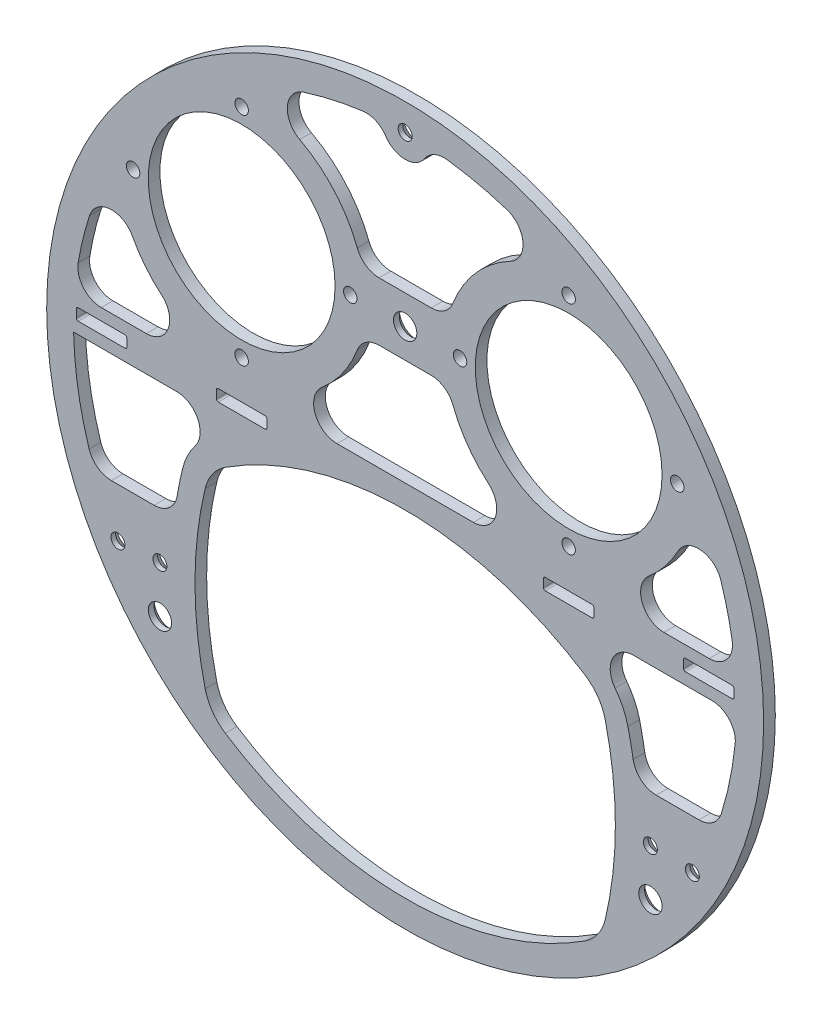
from build123d import *

# Parameters (mm, degrees)
SKETCH1_R                                     = 97.4725
SKETCH1_R_2                                   = 90.16999999999999
BOSS_EXTRUDE1_DEPTH                           = 3.175
BOSS_EXTRUDE2_START                           = -3.175
BOSS_EXTRUDE2_DEPTH                           = 3.175
CIRPATTERN2_COUNT                             = 3
BOSS_EXTRUDE3_DEPTH                           = 3.175
FILLET1_R                                     = 3.175
BOSS_EXTRUDE4_DEPTH                           = 3.175
SKETCH11_R                                    = 3.174999999999997
CUT_EXTRUDE1_DEPTH                            = 138.88349117098826
CHAMFER1_SIZE                                 = 1.5875
CSK_FOR_6_FLAT_HEAD_MACHINE_SCREW1_AT_2_COUNT = 2
CSK_FOR_6_FLAT_HEAD_MACHINE_SCREW1_AT_2_PITCH = 133.35000000000002
BOSS_EXTRUDE5_DEPTH                           = 3.175
BOSS_EXTRUDE6_START                           = -3.175
SKETCH16_R                                    = 25.4
SKETCH16_R_2                                  = 25.400000000000002
BOSS_EXTRUDE6_DEPTH                           = 3.175
FILLET2_R                                     = 6.35
FILLET5_DEPTH                                 = 3.175
CIRPATTERN3_COUNT                             = 4
SKETCH19_R                                    = 3.174999999999999
CUT_EXTRUDE2_DEPTH                            = 138.88349117098826
CHAMFER2_SIZE                                 = 1.5875
FILLET6_R                                     = 0.508


with BuildPart() as part:
    # Sketch1 → Boss-Extrude1 (new body)
    with BuildSketch(Plane.XY):
        Circle(SKETCH1_R)
        Circle(SKETCH1_R_2, mode=Mode.SUBTRACT)
    extrude(amount=BOSS_EXTRUDE1_DEPTH)

    # Sketch2 → Boss-Extrude2 (add)
    with BuildSketch(Plane.XY.offset(3.175).offset(BOSS_EXTRUDE2_START)):
        with BuildLine():
            ThreePointArc((-5.291472463870123, 86.65961267605633), (-1.02e-15, 83.81999999999998), (5.291472463870119, 86.65961267605633))
            ThreePointArc((5.291472463870119, 86.65961267605633), (7.9402616920959765, 88.92319498452717), (11.38468317984177, 89.4484090909091))
            ThreePointArc((11.38468317984177, 89.4484090909091), (5.52e-15, 90.17), (-11.38468317984177, 89.4484090909091))
            ThreePointArc((-11.38468317984177, 89.4484090909091), (-7.940261692095977, 88.92319498452717), (-5.291472463870123, 86.65961267605633))
        make_face()
    boss_extrude2 = extrude(amount=BOSS_EXTRUDE2_DEPTH)

    # Sketch7 → CSK for #6 Flat Head Machine Screw2 (revolve, cut)
    with BuildSketch(Plane(origin=(0, 90.16999999999999, 0), x_dir=(0, 1, 0), z_dir=(1, 0, 0))):
        Polygon((0, 0), (-7.8e-16, 3.1749999999999994), (1.8986499999999988, 3.1749999999999994), (1.898649999999999, 1.891953400936034), (3.5433, 0), align=None)
    csk_for_6_flat_head_machine_screw2 = revolve(axis=Axis((0, 90.16999999999999, -6.349999999999991), (0, 0, 1)), mode=Mode.SUBTRACT)

    # CirPattern2: Boss-Extrude2, CSK for #6 Flat Head Machine Screw2 ×3 about axis
    cirpattern2_axis = Axis((-3.86e-15, -4.54e-15, 0), (0, 0, 1))
    add([boss_extrude2.rotate(cirpattern2_axis, i * 360 / CIRPATTERN2_COUNT) for i in range(1, CIRPATTERN2_COUNT)])
    add([csk_for_6_flat_head_machine_screw2.rotate(cirpattern2_axis, i * 360 / CIRPATTERN2_COUNT) for i in range(1, CIRPATTERN2_COUNT)], mode=Mode.SUBTRACT)

    # Sketch9 → Boss-Extrude3 (add)
    with BuildSketch(Plane.XY):
        with BuildLine():
            ThreePointArc((-60.552516274363704, -19.396575562370977), (-63.50000000000001, -44.44999999999999), (-60.55251627436369, -69.50342443762905))
            ThreePointArc((-60.55251627436369, -69.50342443762905), (-57.57296062941026, -76.08635223992763), (-52.35610155826709, -81.08605940370039))
            ThreePointArc((-52.35610155826709, -81.08605940370039), (2.734e-14, -96.52000000000004), (52.35610155826709, -81.08605940370035))
            ThreePointArc((52.35610155826709, -81.08605940370035), (57.57296062941024, -76.0863522399276), (60.55251627436368, -69.50342443762905))
            ThreePointArc((60.55251627436368, -69.50342443762905), (63.49999999999998, -44.45000000000001), (60.55251627436369, -19.396575562370966))
            ThreePointArc((60.55251627436369, -19.396575562370966), (57.57296062941026, -12.813647760072387), (52.356101558267085, -7.81394059629963))
            ThreePointArc((52.356101558267085, -7.81394059629963), (8.1e-16, 7.6200000000000045), (-52.35610155826708, -7.8139405962996396))
            ThreePointArc((-52.35610155826708, -7.8139405962996396), (-57.572960629410254, -12.813647760072396), (-60.552516274363704, -19.396575562370977))
        make_face()
        with BuildLine():
            ThreePointArc((48.911621192591625, -13.148549767595705), (2.185e-14, 1.2700000000000102), (-48.911621192591625, -13.148549767595705))
            ThreePointArc((-48.911621192591625, -13.148549767595705), (-52.389527240020406, -16.481687876777546), (-54.37589766998936, -20.87030641164326))
            ThreePointArc((-54.37589766998936, -20.87030641164326), (-57.15000000000001, -44.44999999999999), (-54.37589766998935, -68.02969358835675))
            ThreePointArc((-54.37589766998935, -68.02969358835675), (-52.389527240020385, -72.41831212322246), (-48.91162119259161, -75.7514502324043))
            ThreePointArc((-48.91162119259161, -75.7514502324043), (5.52e-15, -90.17), (48.91162119259161, -75.7514502324043))
            ThreePointArc((48.91162119259161, -75.7514502324043), (52.389527240020385, -72.41831212322246), (54.37589766998935, -68.02969358835675))
            ThreePointArc((54.37589766998935, -68.02969358835675), (57.15, -44.45), (54.37589766998936, -20.87030641164326))
            ThreePointArc((54.37589766998936, -20.87030641164326), (52.389527240020406, -16.481687876777542), (48.911621192591625, -13.148549767595705))
        make_face(mode=Mode.SUBTRACT)
    extrude(amount=BOSS_EXTRUDE3_DEPTH)

    # Fillet1
    fillet1_edges = [part.edges().sort_by_distance(p)[0] for p in [
        (-61.30114192312411, -66.12714192312407, 1.5875),
        (61.30114192312409, -66.1271419231241, 1.5875),
    ]]
    fillet(fillet1_edges, radius=FILLET1_R)

    # Sketch10 → Boss-Extrude4 (add)
    with BuildSketch(Plane(origin=(0, 0, 0), x_dir=(-1, 0, 0), z_dir=(0, 0, -1))):
        with BuildLine():
            Line((-84.39529844724764, -31.75), (-62.75033815245173, -31.749999999999993))
            ThreePointArc((-62.75033815245173, -31.749999999999993), (-63.49920304425165, -44.035196298316606), (-62.84477262950386, -56.325784874401805))
            ThreePointArc((-62.84477262950386, -56.325784874401805), (-64.73526297869294, -59.58708179111672), (-68.40927865363547, -58.74350597376062))
            ThreePointArc((-68.40927865363547, -58.74350597376062), (-70.12162004863966, -56.688511197192476), (-71.77225301090981, -54.58362939323426))
            ThreePointArc((-71.77225301090981, -54.58362939323426), (-73.03961499623, -51.33806583031444), (-72.40368982765013, -47.91235591516485))
            ThreePointArc((-72.40368982765013, -47.91235591516485), (-72.59024934521202, -41.909999999999314), (-77.69516229152016, -38.74725676089008))
            ThreePointArc((-77.69516229152016, -38.74725676089008), (-80.97987668832585, -37.5851291542113), (-83.1569361907514, -34.86477969767339))
            ThreePointArc((-83.1569361907514, -34.86477969767339), (-83.7905919312427, -33.31314461007798), (-84.39529844724764, -31.75))
        make_face()
        with BuildLine():
            Line((62.75033815245173, -31.749999999999993), (84.39529844724764, -31.75))
            ThreePointArc((84.39529844724764, -31.75), (83.79059193124246, -33.31314461007858), (83.15693619075093, -34.86477969767456))
            ThreePointArc((83.15693619075093, -34.86477969767456), (80.97987668832535, -37.58512915421244), (77.69516229151964, -38.74725676089117))
            ThreePointArc((77.69516229151964, -38.74725676089117), (72.59024934521145, -41.91000000000033), (72.40368982764947, -47.912355915165875))
            ThreePointArc((72.40368982764947, -47.912355915165875), (73.03961499622928, -51.338065830315465), (71.77225301090904, -54.583629393235256))
            ThreePointArc((71.77225301090904, -54.583629393235256), (70.12162004863924, -56.68851119719296), (68.4092786536355, -58.743505973760605))
            ThreePointArc((68.4092786536355, -58.743505973760605), (64.73526297869296, -59.58708179111668), (62.84477262950386, -56.32578487440178))
            ThreePointArc((62.84477262950386, -56.32578487440178), (63.49920304425165, -44.0351962983166), (62.75033815245173, -31.749999999999993))
        make_face()
    extrude(amount=-BOSS_EXTRUDE4_DEPTH)

    # Sketch11 → Cut-Extrude1 (cut, through all)
    with BuildSketch(Plane(origin=(0, 0, 0), x_dir=(-1, 0, 0), z_dir=(0, 0, -1))):
        with Locations((-66.675, -57.150000000000006)):
            Circle(SKETCH11_R)
        with Locations((66.67500000000003, -57.14999999999999)):
            Circle(SKETCH11_R)
    extrude(amount=-CUT_EXTRUDE1_DEPTH, mode=Mode.SUBTRACT)

    # Chamfer1
    chamfer1_edges = [part.edges().sort_by_distance(p)[0] for p in [
        (69.85, -57.150000000000006, 0),
        (-63.50000000000003, -57.14999999999999, 0),
    ]]
    chamfer(chamfer1_edges, length=CHAMFER1_SIZE)

    # Sketch12 → CSK for #6 Flat Head Machine Screw1 (revolve, cut)
    with BuildSketch(Plane(origin=(-66.67500000000003, -44.45, 0), x_dir=(0, 1, 0), z_dir=(1, 0, 0))):
        Polygon((0, 0), (-7.8e-16, 3.175000000000011), (1.8986499999999988, 3.175000000000011), (1.898649999999999, 1.8919534009360337), (3.5433, 0), align=None)
    csk_for_6_flat_head_machine_screw1 = revolve(axis=Axis((-66.67500000000003, -44.45, -6.349999999999991), (0, 0, 1)), mode=Mode.SUBTRACT)

    # CSK for #6 Flat Head Machine Screw1 at 2: CSK for #6 Flat Head Machine Screw1 ×2
    with Locations(*[(i * CSK_FOR_6_FLAT_HEAD_MACHINE_SCREW1_AT_2_PITCH, 0, 0) for i in range(1, CSK_FOR_6_FLAT_HEAD_MACHINE_SCREW1_AT_2_COUNT)]):
        add(csk_for_6_flat_head_machine_screw1, mode=Mode.SUBTRACT)

    # Sketch14 → Boss-Extrude5 (add)
    with BuildSketch(Plane(origin=(0, 0, 0), x_dir=(-1, 0, 0), z_dir=(0, 0, -1))):
        with BuildLine():
            Line((-90.1498745146104, -1.9050000000000002), (-23.71705873415999, -1.9049999999976532))
            ThreePointArc((-23.71705873415999, -1.9049999999976532), (4.43402e-12, 1.2700000000000102), (23.717058734168575, -1.9050000000000038))
            Line((23.717058734168575, -1.9050000000000038), (90.1498745146104, -1.9050000000000002))
            ThreePointArc((90.1498745146104, -1.9050000000000002), (90.12458448611855, 2.8614980699766988), (89.84745127158588, 7.62))
            Line((89.84745127158588, 7.62), (-89.84745127158588, 7.62))
            ThreePointArc((-89.84745127158588, 7.62), (-90.12458448611854, 2.861498069976714), (-90.1498745146104, -1.9050000000000002))
        make_face()
        Polygon((-89.40800000000002, 4.444999999999994), (-75.69200000000001, 4.445), (-75.69200000000001, 1.27), (-89.40800000000002, 1.2699999999999942), align=None, mode=Mode.SUBTRACT)
        Polygon((89.40800000000002, 1.2699999999999942), (75.69200000000001, 1.27), (75.69200000000001, 4.445), (89.40800000000002, 4.444999999999994), align=None, mode=Mode.SUBTRACT)
        Polygon((-51.30800000000001, 4.445), (-37.592, 4.445000000000003), (-37.592, 1.2700000000000151), (-51.30800000000001, 1.2700000000000125), align=None, mode=Mode.SUBTRACT)
        Polygon((51.30800000000001, 4.4449999999999985), (37.592, 4.444999999999994), (37.592, 1.2700000000000744), (51.30800000000001, 1.2700000000000786), align=None, mode=Mode.SUBTRACT)
    extrude(amount=-BOSS_EXTRUDE5_DEPTH)

    # Sketch16 → Boss-Extrude6 (add)
    with BuildSketch(Plane.XY.offset(3.175).offset(BOSS_EXTRUDE6_START)):
        with BuildLine():
            Line((-48.577499999999986, 11.049060361271266), (-48.577499999999986, 7.62))
            Line((-48.577499999999986, 7.62), (-40.3225, 7.620000000000001))
            Line((-40.3225, 7.620000000000001), (-40.32249999999999, 11.04906036127127))
            ThreePointArc((-40.32249999999999, 11.04906036127127), (-22.061036671085663, 19.32245841598248), (-11.744417620993202, 36.512499999999996))
            Line((-11.744417620993202, 36.512499999999996), (11.744417620993215, 36.512499999999996))
            ThreePointArc((11.744417620993215, 36.512499999999996), (22.061036671085677, 19.32245841598249), (40.3225, 11.049060361271291))
            Line((40.3225, 11.049060361271291), (40.3225, 7.620000000000002))
            Line((40.3225, 7.620000000000002), (48.57749999999999, 7.620000000000002))
            Line((48.57749999999999, 7.620000000000002), (48.57749999999999, 11.049060361271291))
            ThreePointArc((48.57749999999999, 11.049060361271291), (69.86838174394867, 22.3917839678977), (78.09932549133126, 45.0679959372402))
            ThreePointArc((78.09932549133126, 45.0679959372402), (63.759818459591, 63.759818459590996), (45.0679959372402, 78.09932549133126))
            ThreePointArc((45.0679959372402, 78.09932549133126), (23.890870800575495, 71.0954730031458), (11.744417620993215, 52.387499999999996))
            Line((11.744417620993215, 52.387499999999996), (-11.744417620993202, 52.387499999999996))
            ThreePointArc((-11.744417620993202, 52.387499999999996), (-23.89087080057551, 71.09547300314578), (-45.0679959372402, 78.09932549133126))
            ThreePointArc((-45.0679959372402, 78.09932549133126), (-63.759818459590996, 63.759818459591), (-78.09932549133126, 45.0679959372402))
            ThreePointArc((-78.09932549133126, 45.0679959372402), (-69.8683817439487, 22.391783967897677), (-48.577499999999986, 11.049060361271266))
        make_face()
        with Locations((-44.449999999999996, 44.449999999999996)):
            Circle(SKETCH16_R, mode=Mode.SUBTRACT)
        with Locations((44.449999999999996, 44.449999999999996)):
            Circle(SKETCH16_R_2, mode=Mode.SUBTRACT)
    extrude(amount=BOSS_EXTRUDE6_DEPTH)

    # Fillet2
    # the kernel refuses this fillet: 6.35 mm, written as the material it adds along each edge
    with BuildSketch(Plane(origin=(-84.39529844724763, -31.75, 0), x_dir=(-0.3276820546937395, 0.944788056143646, 0), z_dir=(0, 0, 1))) as fillet2_piece_1:
        with BuildLine():
            CenterArc((4.519448582816029, -6.347857408743958), FILLET2_R, 88.51155550579041, 72.36029860576407)
            Line((-1.4799555736961292, -4.2670763614387255), (-1.5999436568263712, -4.225460740492621))
            Line((-1.5999436568263712, -4.225460740492621), (-0.119988083130242, 0.04161562094610455))
            Line((-0.119988083130242, 0.04161562094610455), (-0.00329886757869787, 0.1269571481748834))
            ThreePointArc((-0.00329886757869787, 0.1269571481748834), (2.342195980875504, 0.1574247958358037), (4.6876908293296315, 0.1269571481748854))
            Line((4.6876908293296315, 0.1269571481748854), (4.684391961750932, 6e-17))
        make_face()
    extrude(amount=3.175)
    with BuildSketch(Plane(origin=(-62.75033815245174, -31.749999999999993, 0), x_dir=(0.14220046301062747, 0.9898378798164694, 0), z_dir=(0, 0, 1))) as fillet2_piece_2:
        with BuildLine():
            CenterArc((5.503228389863832, 6.348053018392141), FILLET2_R, 188.17519762872402, 80.40593177313968)
            Line((-0.7822421469707487, 5.445080078274671), (-0.9079515577074392, 5.427020619472321))
            Line((-0.9079515577074392, 5.427020619472321), (-0.1257094107366905, -0.01805945880234953))
            Line((-0.1257094107366905, -0.01805945880234953), (0.00314470193706393, -0.12696106036784421))
            ThreePointArc((0.00314470193706393, -0.12696106036784421), (2.6729966465052866, -0.0939013126663504), (5.342848591073519, -0.12696106036784152))
            Line((5.342848591073519, -0.12696106036784152), (5.345993293010584, -5e-17))
        make_face()
    extrude(amount=3.175)
    with BuildSketch(Plane(origin=(84.39529844724765, -31.750000000000004, 0), x_dir=(0.327682054693733, 0.9447880561436482, 0), z_dir=(0, 0, 1))) as fillet2_piece_3:
        with BuildLine():
            CenterArc((4.519448582816035, 6.347857408743959), FILLET2_R, 199.12814588844535, 72.36029860576383)
            Line((-1.479955573696128, 4.267076361438741), (-1.5999436568263703, 4.225460740492637))
            Line((-1.5999436568263703, 4.225460740492637), (-0.11998808313024228, -0.04161562094610373))
            Line((-0.11998808313024228, -0.04161562094610373), (-0.00329886757869874, -0.1269571481748834))
            ThreePointArc((-0.00329886757869874, -0.1269571481748834), (2.3421959808753874, -0.15742479583579977), (4.687690829329593, -0.12695714817488565))
            Line((4.687690829329593, -0.12695714817488565), (4.684391961750894, -1e-16))
        make_face()
    extrude(amount=3.175)
    with BuildSketch(Plane(origin=(62.75033815245174, -31.749999999999993, 0), x_dir=(1, -1.29e-15, 0), z_dir=(0, 0, 1))) as fillet2_piece_4:
        with BuildLine():
            CenterArc((5.500981715595926, 6.350000000000001), FILLET2_R, 189.5940682268604, 80.40593177313968)
            Line((-0.7602027215178351, 5.291666666666674), (-0.8854264102601089, 5.270500000000008))
            ThreePointArc((-0.8854264102601089, 5.270500000000008), (-0.4730484370005817, 2.632480523194864), (-0.12611804488523856, -0.01494117647058973))
            Line((-0.12611804488523856, -0.01494117647058973), (1.6e-16, -0.1269999999999989))
            Line((1.6e-16, -0.1269999999999989), (5.500981715595934, -0.1269999999999989))
            Line((5.500981715595934, -0.1269999999999989), (5.500981715595934, 0))
        make_face()
    extrude(amount=3.175)
    with BuildSketch(Plane(origin=(90.14987451461042, -1.9050000000000002, 0), x_dir=(-1, 3.546e-14, 0), z_dir=(0, 0, 1))) as fillet2_piece_5:
        with BuildLine():
            CenterArc((6.737361214746118, 6.35), FILLET2_R, 174.3480720098043, 95.65192799019565)
            Line((0.41823141930184127, 6.975378787878556), (0.2918488233929617, 6.987886363636128))
            ThreePointArc((0.2918488233929617, 6.987886363636128), (0.01474661668818936, 3.499343422213633), (-0.126971654245935, 0.00268309859154486))
            Line((-0.126971654245935, 0.00268309859154486), (4.5e-15, -0.127))
            Line((4.5e-15, -0.127), (6.73736121474612, -0.127))
            Line((6.73736121474612, -0.127), (6.737361214746116, 0))
        make_face()
    extrude(amount=3.175)
    with BuildSketch(Plane(origin=(89.8474512715859, 7.620000000000001, 0), x_dir=(-0.12569466129192156, 0.9920689754864372, 0), z_dir=(0, 0, 1))) as fillet2_piece_6:
        with BuildLine():
            CenterArc((7.204616516020998, 6.344553679726352), FILLET2_R, 172.77912664698883, 99.59406822686049)
            Line((0.9049785216821223, 7.142714778930054), (0.7789857617953451, 7.1586780009141275))
            Line((0.7789857617953451, 7.1586780009141275), (-0.1259927598867773, 0.01596322198407401))
            Line((-0.1259927598867773, 0.01596322198407401), (-0.00525884417227798, -0.12689107359452478))
            ThreePointArc((-0.00525884417227798, -0.12689107359452478), (3.733779362317438, -0.20433774788573073), (7.472817568807157, -0.12689107359453283))
            Line((7.472817568807157, -0.12689107359453283), (7.4675587246348805, -5e-17))
        make_face()
    extrude(amount=3.175)
    with BuildSketch(Plane(origin=(-89.8474512715859, 7.620000000000001, 0), x_dir=(1, -2.5e-16, 0), z_dir=(0, 0, 1))) as fillet2_piece_7:
        with BuildLine():
            CenterArc((7.199816701684268, 6.35), FILLET2_R, 170.4059317731395, 99.59406822686049)
            Line((0.9386322645705132, 7.408333333333337), (0.813408575828232, 7.429500000000004))
            ThreePointArc((0.813408575828232, 7.429500000000004), (0.26659899208705345, 3.729850830676309), (-0.12654570601631576, 0.01073239436619741))
            Line((-0.12654570601631576, 0.01073239436619741), (3e-17, -0.12699999999999978))
            Line((3e-17, -0.12699999999999978), (7.19981670168427, -0.12699999999999978))
            Line((7.19981670168427, -0.12699999999999978), (7.19981670168427, 0))
        make_face()
    extrude(amount=3.175)
    with BuildSketch(Plane(origin=(41.80885522230552, -1.904999999998295, 3.175), x_dir=(0.8305102494948581, -0.5570033442305249, 0), z_dir=(0, 0, -1))) as fillet2_piece_8:
        with BuildLine():
            CenterArc((20.386093294144406, -6.026562759071867), FILLET2_R, 108.36566414374015, 127.7855245463357)
            Line((16.849122058280763, -11.300302843364342), (16.495424934694398, -11.827676851793589))
            Line((16.495424934694398, -11.827676851793589), (-0.3536971235863656, -0.5273740084292468))
            Line((-0.3536971235863656, -0.5273740084292468), (0.09035409966818549, 0.628538890342635))
            ThreePointArc((0.09035409966818549, 0.628538890342635), (12.061967749032272, -0.3325122850063933), (18.185257092544806, 0.6026562759071861))
            Line((18.185257092544806, 0.6026562759071861), (18.38533311087204, 6.9e-16))
        make_face()
    extrude(amount=3.175)
    with BuildSketch(Plane(origin=(78.09932549133126, 45.0679959372402, 0), x_dir=(0.4054403175885449, -0.9141215175641036, 0), z_dir=(0, 0, 1))) as fillet2_piece_9:
        with BuildLine():
            CenterArc((18.394680320310908, -6.3144124313199015), FILLET2_R, 83.93119807175825, 134.18918929468322)
            Line((13.399037439333416, -10.234368069555982), (13.299124581713865, -10.312767182320702))
            ThreePointArc((13.299124581713865, -10.312767182320702), (7.27371358798781, -4.365436737258598), (-0.04935045218809739, -0.11701936963096554))
            Line((-0.04935045218809739, -0.11701936963096554), (-0.01342677395643252, 0.12628824862639984))
            ThreePointArc((-0.01342677395643252, 0.12628824862639984), (9.533009509066224, 0.6323434752574556), (19.079445792088894, 0.12628824862639437))
            Line((19.079445792088894, 0.12628824862639437), (19.06601901813246, -1.2e-16))
        make_face()
    extrude(amount=3.175)
    with BuildSketch(Plane(origin=(-78.09932549133126, 45.0679959372402, 0), x_dir=(-0.40544031758854426, -0.914121517564104, 0), z_dir=(0, 0, 1))) as fillet2_piece_10:
        with BuildLine():
            CenterArc((18.394680320311004, 6.314412431319899), FILLET2_R, 141.8796126335585, 134.18918929468327)
            Line((13.399037439333513, 10.234368069555982), (13.299124581713963, 10.312767182320702))
            ThreePointArc((13.299124581713963, 10.312767182320702), (7.2737135879878645, 4.365436737258584), (-0.0493504521880973, 0.11701936963096558))
            Line((-0.0493504521880973, 0.11701936963096558), (-0.0134267739564326, -0.12628824862639984))
            ThreePointArc((-0.0134267739564326, -0.12628824862639984), (9.533009509066268, -0.6323434752574738), (19.079445792088993, -0.1262882486263954))
            Line((19.079445792088993, -0.1262882486263954), (19.06601901813256, -5e-17))
        make_face()
    extrude(amount=3.175)
    with BuildSketch(Plane(origin=(45.0679959372402, 78.09932549133126, 0), x_dir=(-0.9141215175641038, 0.40544031758854454, 0), z_dir=(0, 0, 1))) as fillet2_piece_11:
        with BuildLine():
            CenterArc((18.394680320310954, 6.314412431319899), FILLET2_R, 141.87961263355857, 134.1891892946832)
            Line((13.399037439333457, 10.234368069555977), (13.299124581713906, 10.312767182320698))
            ThreePointArc((13.299124581713906, 10.312767182320698), (7.273713587987836, 4.365436737258575), (-0.04935045218809735, 0.11701936963096554))
            Line((-0.04935045218809735, 0.11701936963096554), (-0.01342677395643255, -0.12628824862639984))
            ThreePointArc((-0.01342677395643255, -0.12628824862639984), (9.533009509066256, -0.6323434752574599), (19.07944579208894, -0.12628824862639568))
            Line((19.07944579208894, -0.12628824862639568), (19.066019018132508, -3.7e-16))
        make_face()
    extrude(amount=3.175)
    with BuildSketch(Plane(origin=(-45.0679959372402, 78.09932549133126, 0), x_dir=(0.9141215175641038, 0.40544031758854443, 0), z_dir=(0, 0, 1))) as fillet2_piece_12:
        with BuildLine():
            CenterArc((18.394680320310957, -6.3144124313199), FILLET2_R, 83.93119807175822, 134.18918929468344)
            Line((13.399037439333474, -10.234368069556), (13.299124581713928, -10.312767182320721))
            ThreePointArc((13.299124581713928, -10.312767182320721), (7.273713587987837, -4.36543673725859), (-0.04935045218809733, -0.11701936963096554))
            Line((-0.04935045218809733, -0.11701936963096554), (-0.01342677395643256, 0.12628824862639984))
            ThreePointArc((-0.01342677395643256, 0.12628824862639984), (9.533009509066249, 0.6323434752574639), (19.079445792088947, 0.1262882486263948))
            Line((19.079445792088947, 0.1262882486263948), (19.066019018132515, -5.2e-16))
        make_face()
    extrude(amount=3.175)
    with BuildSketch(Plane(origin=(-11.744417620993204, 52.387499999999996, 0), x_dir=(1, 0, 0), z_dir=(0, 0, 1))) as fillet2_piece_13:
        with BuildLine():
            CenterArc((4.6610788144956175, 6.350000000000001), FILLET2_R, 200.92483242763834, 69.07516757236169)
            Line((-1.2701372479650814, 4.0821428571428555), (-1.3887615692142958, 4.036785714285713))
            ThreePointArc((-1.3887615692142958, 4.036785714285713), (-0.6914497145531637, 2.0235287492187695), (-0.12341729199625284, -0.02995283018867667))
            Line((-0.12341729199625284, -0.02995283018867667), (0, -0.12700000000000244))
            Line((0, -0.12700000000000244), (4.6610788144956175, -0.12700000000000244))
            Line((4.6610788144956175, -0.12700000000000244), (4.6610788144956175, 0))
        make_face()
    extrude(amount=3.175)
    with BuildSketch(Plane(origin=(11.744417620993216, 52.3875, 0), x_dir=(0.2970958228709946, 0.9548476695434757, 0), z_dir=(0, 0, 1))) as fillet2_piece_14:
        with BuildLine():
            CenterArc((4.678495655741924, 6.3371787188104385), FILLET2_R, 197.28325472832518, 69.07516757236169)
            Line((-1.3847870458591474, 4.450620243579621), (-1.506052699891171, 4.412889074075004))
            Line((-1.506052699891171, 4.412889074075004), (-0.12126565403202375, -0.03773116950461704))
            Line((-0.12126565403202375, -0.03773116950461704), (0.00806637182024717, -0.12674357437620873))
            ThreePointArc((0.00806637182024717, -0.12674357437620873), (2.1375885323648376, -0.05904720969532414), (4.26711069290944, -0.12674357437620906))
            Line((4.26711069290944, -0.12674357437620906), (4.275177064729683, -1.4e-16))
        make_face()
    extrude(amount=3.175)
    with BuildSketch(Plane(origin=(-11.7444176209932, 36.512499999999996, 0), x_dir=(-0.29709582287099584, -0.9548476695434754, 0), z_dir=(0, 0, 1))) as fillet2_piece_15:
        with BuildLine():
            CenterArc((4.678495655741923, 6.337178718810438), FILLET2_R, 197.2832547283252, 69.07516757236169)
            Line((-1.384787045859145, 4.450620243579618), (-1.5060526998911685, 4.412889074075))
            Line((-1.5060526998911685, 4.412889074075), (-0.12126565403202372, -0.0377311695046172))
            Line((-0.12126565403202372, -0.0377311695046172), (0.00806637182024733, -0.12674357437620876))
            ThreePointArc((0.00806637182024733, -0.12674357437620876), (2.1375885323648434, -0.05904720969531434), (4.267110692909442, -0.12674357437620878))
            Line((4.267110692909442, -0.12674357437620878), (4.275177064729686, -4e-17))
        make_face()
    extrude(amount=3.175)
    with BuildSketch(Plane(origin=(11.744417620993213, 36.512499999999996, 0), x_dir=(-1, 0, 0), z_dir=(0, 0, 1))) as fillet2_piece_16:
        with BuildLine():
            CenterArc((4.661078814495628, 6.350000000000001), FILLET2_R, 200.92483242763828, 69.07516757236169)
            Line((-1.2701372479650743, 4.082142857142863), (-1.3887615692142887, 4.03678571428572))
            ThreePointArc((-1.3887615692142887, 4.03678571428572), (-0.691449714553162, 2.0235287492187624), (-0.12341729199625284, -0.02995283018867667))
            Line((-0.12341729199625284, -0.02995283018867667), (0, -0.12700000000000244))
            Line((0, -0.12700000000000244), (4.661078814495628, -0.12700000000000244))
            Line((4.661078814495628, -0.12700000000000244), (4.661078814495628, 0))
        make_face()
    extrude(amount=3.175)
    with BuildSketch(Plane(origin=(48.57749999999999, 11.049060361271296, 0), x_dir=(0.9819287119830512, 0.18925116798399397, 0), z_dir=(0, 0, 1))) as fillet2_piece_17:
        with BuildLine():
            CenterArc((4.9644850045874405, -6.3355614781763165), FILLET2_R, 93.86451021576225, 58.26494748243546)
            Line((-0.6489536784582156, -3.367092823855256), (-0.7612224521191276, -3.3077234507688353))
            ThreePointArc((-0.7612224521191276, -3.3077234507688353), (-0.44918178565095424, -1.6595115135936611), (-0.1247049464218499, 0.0240348983339677))
            Line((-0.1247049464218499, 0.0240348983339677), (0.00855945690446086, 0.1267112295635259))
            ThreePointArc((0.00855945690446086, 0.1267112295635259), (2.2682560796821982, 0.05047583433448046), (4.527952702459932, 0.12671122956352573))
            Line((4.527952702459932, 0.12671122956352573), (4.536512159364391, 6e-17))
        make_face()
    extrude(amount=3.175)
    with BuildSketch(Plane(origin=(40.3225, 11.04906036127129, 0), x_dir=(-0.981928711983052, 0.1892511679839907, 0), z_dir=(0, 0, 1))) as fillet2_piece_18:
        with BuildLine():
            CenterArc((4.964485004587459, 6.3355614781763165), FILLET2_R, 207.8705423018023, 58.26494748243533)
            Line((-0.6489536784581964, 3.367092823855255), (-0.7612224521191084, 3.307723450768834))
            ThreePointArc((-0.7612224521191084, 3.307723450768834), (-0.449181785650948, 1.6595115135936593), (-0.12470494642185, -0.02403489833396728))
            Line((-0.12470494642185, -0.02403489833396728), (0.00855945690446044, -0.12671122956352593))
            ThreePointArc((0.00855945690446044, -0.12671122956352593), (2.2682560796821973, -0.05047583433448113), (4.527952702459936, -0.12671122956352562))
            Line((4.527952702459936, -0.12671122956352562), (4.5365121593643964, -9e-17))
        make_face()
    extrude(amount=3.175)
    with BuildSketch(Plane(origin=(-40.32249999999999, 11.049060361271268, 0), x_dir=(-4.14e-15, -1, 0), z_dir=(0, 0, 1))) as fillet2_piece_19:
        with BuildLine():
            CenterArc((5.281535136397894, 6.073782775792986), FILLET2_R, 194.77359666827078, 58.26494748243516)
            Line((-0.8585402247333149, 4.45453154154011), (-0.9813417319559387, 4.4221465168550536))
            ThreePointArc((-0.9813417319559387, 4.4221465168550536), (-0.4788337833609869, 2.217713160167298), (-0.12604128165557954, -0.0155754716981141))
            Line((-0.12604128165557954, -0.0155754716981141), (5.3e-16, -0.12700000000000244))
            ThreePointArc((5.3e-16, -0.12700000000000244), (1.714530180635633, -0.12699999999999534), (3.3920108657687327, -0.12147565551585886))
            Line((3.3920108657687327, -0.12147565551585886), (3.429060361271265, 0))
        make_face()
    extrude(amount=3.175)
    with BuildSketch(Plane(origin=(-48.577499999999986, 11.049060361271263, 0), x_dir=(-0.9819287119830518, 0.18925116798399214, 0), z_dir=(0, 0, 1))) as fillet2_piece_20:
        with BuildLine():
            CenterArc((4.964485004587444, 6.335561478176317), FILLET2_R, 207.87054230180257, 58.264947482435105)
            Line((-0.6489536784581966, 3.36709282385523), (-0.7612224521191087, 3.3077234507688082))
            ThreePointArc((-0.7612224521191087, 3.3077234507688082), (-0.44918178565094813, 1.6595115135936465), (-0.12470494642184997, -0.02403489833396746))
            Line((-0.12470494642184997, -0.02403489833396746), (0.00855945690446062, -0.12671122956352593))
            ThreePointArc((0.00855945690446062, -0.12671122956352593), (2.2682560796821916, -0.05047583433448437), (4.527952702459931, -0.12671122956352565))
            Line((4.527952702459931, -0.12671122956352565), (4.53651215936439, -3e-17))
        make_face()
    extrude(amount=3.175)
    with BuildSketch(Plane(origin=(-41.80885522230904, -1.904999999999999, 3.175), x_dir=(-1, -1.1e-16, 0), z_dir=(0, 0, -1))) as fillet2_piece_21:
        with BuildLine():
            CenterArc((20.287675038960728, -6.35), FILLET2_R, 90, 127.78552454633092)
            Line((15.269207588953465, -10.240692027546972), (14.767360843952739, -10.62976123030167))
            ThreePointArc((14.767360843952739, -10.62976123030167), (10.202798299390487, -6.442401513429245), (-0.27505825804150413, -0.5723355263157894))
            Line((-0.27505825804150413, -0.5723355263157894), (-7e-17, 0.635))
            Line((-7e-17, 0.635), (20.287675038960728, 0.635))
            Line((20.287675038960728, 0.635), (20.287675038960728, 0))
        make_face()
    extrude(amount=3.175)

    # Fillet5: read off the stored shape, not the designer's step
    # Fillet5 outline → Fillet5 (add)
    with BuildSketch(Plane.XY):
        with BuildLine():
            ThreePointArc((70.360801319, 7.62), (64.400750784, 11.779041849), (66.247975713, 18.808095238))
            ThreePointArc((66.247975713, 18.808095238), (60.026919362, 14.616820348), (53.032031542, 11.907600586))
            ThreePointArc((53.032031542, 11.907600586), (50.247696423, 10.342558256), (48.5775, 7.62))
            Line((48.5775, 7.62), (70.360801319, 7.62))
        make_face()
        with BuildLine():
            ThreePointArc((22.652024287, 18.808095238), (24.499249216, 11.779041849), (18.539198681, 7.62))
            Line((18.539198681, 7.62), (40.3225, 7.62))
            ThreePointArc((40.3225, 7.62), (38.652303577, 10.342558256), (35.867968458, 11.907600586))
            ThreePointArc((35.867968458, 11.907600586), (28.873080638, 14.616820347), (22.652024287, 18.808095238))
        make_face()
        with BuildLine():
            Line((-40.3225, 7.62), (-18.539198681, 7.62))
            ThreePointArc((-18.539198681, 7.62), (-24.499249216, 11.779041849), (-22.652024287, 18.808095238))
            ThreePointArc((-22.652024287, 18.808095238), (-28.873080638, 14.616820347), (-35.867968458, 11.907600586))
            ThreePointArc((-35.867968458, 11.907600586), (-38.652303577, 10.342558256), (-40.3225, 7.62))
        make_face()
        with BuildLine():
            ThreePointArc((-66.247975713, 18.808095238), (-64.400750784, 11.779041849), (-70.360801319, 7.62))
            Line((-70.360801319, 7.62), (-48.5775, 7.62))
            ThreePointArc((-48.5775, 7.62), (-50.247696423, 10.342558256), (-53.032031542, 11.907600586))
            ThreePointArc((-53.032031542, 11.907600586), (-60.026919362, 14.616820348), (-66.247975713, 18.808095238))
        make_face()
    extrude(amount=FILLET5_DEPTH)

    # Sketch17 → #6 Clearance Hole1 (revolve, cut)
    with BuildSketch(Plane(origin=(-14.922500000000001, 44.45, 3.175), x_dir=(0, -1, 0), z_dir=(1, 0, 0))):
        Polygon((0, 0), (-1.73e-15, 7.448853900077602), (1.8287999999999984, 6.35), (1.8287999999999993, 1.9e-16), align=None)
    f_6_clearance_hole1 = revolve(axis=Axis((-14.922500000000001, 44.45, 9.524999999999991), (0, 0, -1)), mode=Mode.SUBTRACT)

    # CirPattern3: #6 Clearance Hole1 ×4 about axis
    cirpattern3_axis = Axis((-44.44999999999999, 44.45000000000005, 0), (0, 0, 1))
    for i in range(1, CIRPATTERN3_COUNT):
        add(f_6_clearance_hole1.rotate(cirpattern3_axis, i * 360 / CIRPATTERN3_COUNT), mode=Mode.SUBTRACT)

    # Mirror1: #6 Clearance Hole1 across plane
    add(f_6_clearance_hole1.mirror(Plane(origin=(0, 0, 0), x_dir=(0, 0, 1), z_dir=(1, 0, 0))), mode=Mode.SUBTRACT)

    # Mirror1 copy 1 sketch → Mirror1 copy 1 (revolve, cut)
    with BuildSketch(Plane(origin=(44.44999999999994, 73.97750000000003, 3.175), x_dir=(-1, -6e-17, 0), z_dir=(-6e-17, 1, 0))):
        Polygon((0, 0), (-1.73e-15, -7.448853900077602), (1.8287999999999984, -6.35), (1.8287999999999993, -1.9e-16), align=None)
    revolve(axis=Axis((44.44999999999994, 73.97750000000003, 9.524999999999991), (0, 0, 1)), mode=Mode.SUBTRACT)

    # Mirror1 copy 2 sketch → Mirror1 copy 2 (revolve, cut)
    with BuildSketch(Plane(origin=(73.97749999999998, 44.45000000000012, 3.175), x_dir=(-1.2e-16, 1, 0), z_dir=(1, 1.2e-16, 0))):
        Polygon((0, 0), (-1.73e-15, -7.448853900077602), (1.8287999999999984, -6.35), (1.8287999999999993, -1.9e-16), align=None)
    revolve(axis=Axis((73.97749999999998, 44.45000000000012, 9.524999999999991), (0, 0, 1)), mode=Mode.SUBTRACT)

    # Mirror1 copy 3 sketch → Mirror1 copy 3 (revolve, cut)
    with BuildSketch(Plane(origin=(44.450000000000045, 14.922500000000063, 3.175), x_dir=(1, 1.8e-16, 0), z_dir=(1.8e-16, -1, 0))):
        Polygon((0, 0), (-1.73e-15, -7.448853900077602), (1.8287999999999984, -6.35), (1.8287999999999993, -1.9e-16), align=None)
    revolve(axis=Axis((44.450000000000045, 14.922500000000063, 9.524999999999991), (0, 0, 1)), mode=Mode.SUBTRACT)

    # Sketch19 → Cut-Extrude2 (cut, through all)
    with BuildSketch(Plane(origin=(0, 0, 0), x_dir=(-1, 0, 0), z_dir=(0, 0, -1))):
        with Locations((-6.94e-15, 44.449999999999996)):
            Circle(SKETCH19_R)
    extrude(amount=-CUT_EXTRUDE2_DEPTH, mode=Mode.SUBTRACT)

    # Chamfer2
    chamfer2_edges = [part.edges().sort_by_distance(p)[0] for p in [
        (3.175000000000006, 44.449999999999996, 0),
    ]]
    chamfer(chamfer2_edges, length=CHAMFER2_SIZE)

    # Fillet6
    fillet6_edges = [part.edges().sort_by_distance(p)[0] for p in [
        (89.40800000000002, 4.444999999999994, 1.5875),
        (75.69200000000001, 4.445, 1.5875),
        (75.69200000000001, 1.27, 1.5875),
        (89.40800000000002, 1.2699999999999942, 1.5875),
        (-89.40800000000002, 1.2699999999999942, 1.5875),
        (-75.69200000000001, 1.27, 1.5875),
        (-75.69200000000001, 4.445, 1.5875),
        (-89.40800000000002, 4.444999999999994, 1.5875),
        (51.30800000000001, 4.445, 1.5875),
        (37.592, 4.445000000000003, 1.5875),
        (37.592, 1.2700000000000151, 1.5875),
        (51.30800000000001, 1.2700000000000125, 1.5875),
        (-51.30800000000001, 1.2700000000000786, 1.5875),
        (-37.592, 1.2700000000000744, 1.5875),
        (-37.592, 4.444999999999994, 1.5875),
        (-51.30800000000001, 4.4449999999999985, 1.5875),
    ]]
    fillet(fillet6_edges, radius=FILLET6_R)


solid = part.part
